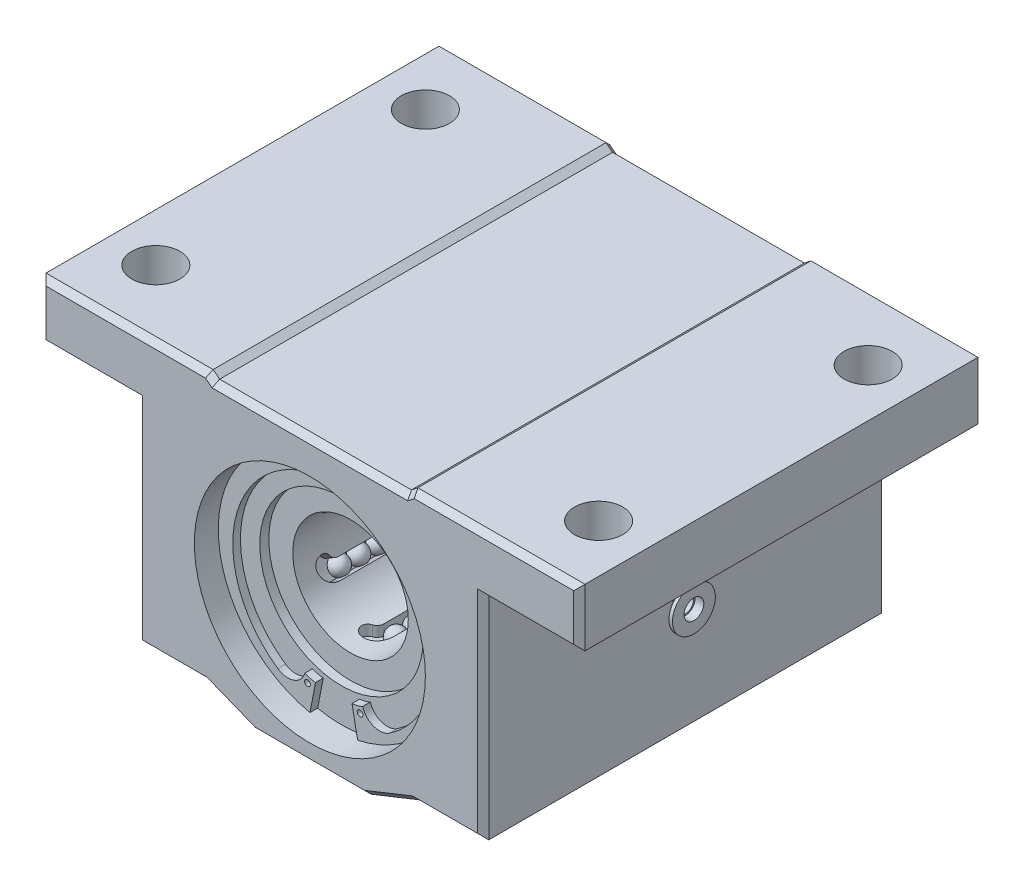
from build123d import *

# Parameters (mm, degrees)
EXTRUDE1_DEPTH          = 16.66875
SKETCH2_R               = 9.525
CUT_EXTRUDE1_DEPTH      = 2.607733333
SKETCH4_R               = 6.7389375
CUT_EXTRUDE2_DEPTH      = 0.745066669
SKETCH5_R               = 4.7625
CUT_EXTRUDE3_DEPTH      = 40.176416988
CUT_EXTRUDE4_REACH      = 32.546
CUT_EXTRUDE4_END_RADIUS = 5.609166668
CIRPATTERN1_COUNT       = 6
LPATTERN1_COUNT         = 7
LPATTERN1_PITCH         = 1.5875
CIRPATTERN2_COUNT       = 6
CHAMFER1_SIZE           = 0.465666667
SKETCH11_R              = 0.6985
CUT_EXTRUDE5_DEPTH      = 0.952499999
SKETCH13_R              = 1.984375
CUT_EXTRUDE6_DEPTH      = 4.7625
SKETCH3_R               = 0.238125
EXTRUDE2_DEPTH          = 0.635


with BuildPart() as part:
    # Sketch1 → Extrude1 (new, symmetric)
    with BuildSketch(Plane.XY):
        Polygon((-22.225, 11.90625), (-8.4455, 11.90625), (-7.90654375, 11.482916667), (7.90654375, 11.482916667), (8.4455, 11.90625), (22.225, 11.90625), (22.225, 7.14375), (14.2875, 7.14375), (14.2875, -10.31875), (8.5725, -10.31875), (4.591070255, -11.90625), (-4.591070255, -11.90625), (-8.5725, -10.31875), (-14.2875, -10.31875), (-14.2875, 7.14375), (-22.225, 7.14375), align=None)
    extrude(amount=EXTRUDE1_DEPTH, both=True)

    # Sketch2 → Cut-Extrude1 (cut)
    with BuildSketch(Plane.XY.offset(16.66875)):
        with Locations((0, -0.79375)):
            Circle(SKETCH2_R)
    cut_extrude1 = extrude(amount=-CUT_EXTRUDE1_DEPTH, mode=Mode.SUBTRACT)

    # Sketch4 → Cut-Extrude2 (cut)
    with BuildSketch(Plane.XY.offset(14.061016667)):
        with Locations((0, -0.79375)):
            Circle(SKETCH4_R)
    cut_extrude2 = extrude(amount=-CUT_EXTRUDE2_DEPTH, mode=Mode.SUBTRACT)

    # Mirror1: Cut-Extrude1, Cut-Extrude2 across plane
    add(cut_extrude1.mirror(Plane.XY), mode=Mode.SUBTRACT)
    add(cut_extrude2.mirror(Plane.XY), mode=Mode.SUBTRACT)

    # Sketch5 → Cut-Extrude3 (cut, through all)
    with BuildSketch(Plane.XY.offset(13.315949998)):
        with Locations((0, -0.79375)):
            Circle(SKETCH5_R)
    extrude(amount=-CUT_EXTRUDE3_DEPTH, mode=Mode.SUBTRACT)

    # Cut-Extrude4: up to this cylinder (the profile starts inside it)
    cut_extrude4_end = Plane(origin=(0, -0.79375, 1.100878), z_dir=(0, 0, 1)) * Cylinder(CUT_EXTRUDE4_END_RADIUS, 77.310333335, mode=Mode.PRIVATE)
    # Sketch8 → Cut-Extrude4 (cut, up to the surface)
    with BuildSketch(Plane(origin=(0, -0.79375, 0), x_dir=(-1, 0, 0), z_dir=(0, 1, 0)), mode=Mode.PRIVATE) as cut_extrude4_sk1:
        with BuildLine():
            Line((0.657225, 9.900558849), (0.657225, -7.698802135))
            ThreePointArc((0.657225, -7.698802135), (0.748651619, -8.048469056), (0.999529688, -8.308634344))
            ThreePointArc((0.999529688, -8.308634344), (1.289948445, -9.047460016), (0.657225, -9.526904976))
            ThreePointArc((0.657225, -9.526904976), (-0.272231509, -9.141911485), (-0.657225, -8.212454976))
            Line((-0.657225, -8.212454976), (-0.657225, 10.41421169))
            ThreePointArc((-0.657225, 10.41421169), (-0.272231509, 11.343668198), (0.657225, 11.72866169))
            ThreePointArc((0.657225, 11.72866169), (1.289948445, 11.24921673), (0.999529688, 10.510391058))
            ThreePointArc((0.999529688, 10.510391058), (0.748651619, 10.250225769), (0.657225, 9.900558849))
        make_face()
    cut_extrude4_tool1 = extrude(cut_extrude4_sk1.sketch, amount=-CUT_EXTRUDE4_REACH, mode=Mode.PRIVATE) & cut_extrude4_end
    cut_extrude4 = cut_extrude4_tool1.solids().sort_by_distance((-0.05578, -0.79375, 1.100878))[0]
    add(cut_extrude4, mode=Mode.SUBTRACT)

    # CirPattern1: Cut-Extrude4 ×6 about axis
    cirpattern1_axis = Axis((0, -0.79375, 0), (0, 0, 1))
    for i in range(1, CIRPATTERN1_COUNT):
        add(cut_extrude4.rotate(cirpattern1_axis, i * 360 / CIRPATTERN1_COUNT), mode=Mode.SUBTRACT)

    # Sketch10 → Revolve2 (revolve)
    with BuildSketch(Plane.XY):
        with BuildLine():
            Line((-0.776287501, -6.332537501), (0.776287501, -6.332537501))
            ThreePointArc((0.776287501, -6.332537501), (0, -5.55625), (-0.776287501, -6.332537501))
        make_face()
    revolve2 = revolve(axis=Axis((-0.776287501, -6.332537501, 0), (1, 0, 0)))

    # LPattern1: Revolve2 ×7
    with Locations(*[(0, 0, i * LPATTERN1_PITCH) for i in range(1, LPATTERN1_COUNT)]):
        add(revolve2)

    # Mirror5: Revolve2 across plane
    add(revolve2.mirror(Plane.XY))

    # Mirror5 copy 1 sketch → Mirror5 copy 1 (revolve)
    with BuildSketch(Plane(origin=(0, 0, -1.5875), x_dir=(1, 0, 0), z_dir=(0, 0, -1))):
        with BuildLine():
            Line((-0.776287501, 6.332537501), (0.776287501, 6.332537501))
            ThreePointArc((0.776287501, 6.332537501), (0, 5.55625), (-0.776287501, 6.332537501))
        make_face()
    revolve(axis=Axis((-0.776287501, -6.332537501, -1.5875), (-1, 0, 0)))

    # Mirror5 copy 2 sketch → Mirror5 copy 2 (revolve)
    with BuildSketch(Plane(origin=(0, 0, -3.175), x_dir=(1, 0, 0), z_dir=(0, 0, -1))):
        with BuildLine():
            Line((-0.776287501, 6.332537501), (0.776287501, 6.332537501))
            ThreePointArc((0.776287501, 6.332537501), (0, 5.55625), (-0.776287501, 6.332537501))
        make_face()
    revolve(axis=Axis((-0.776287501, -6.332537501, -3.175), (-1, 0, 0)))

    # Mirror5 copy 3 sketch → Mirror5 copy 3 (revolve)
    with BuildSketch(Plane(origin=(0, 0, -4.7625), x_dir=(1, 0, 0), z_dir=(0, 0, -1))):
        with BuildLine():
            Line((-0.776287501, 6.332537501), (0.776287501, 6.332537501))
            ThreePointArc((0.776287501, 6.332537501), (0, 5.55625), (-0.776287501, 6.332537501))
        make_face()
    revolve(axis=Axis((-0.776287501, -6.332537501, -4.7625), (-1, 0, 0)))

    # Mirror5 copy 4 sketch → Mirror5 copy 4 (revolve)
    with BuildSketch(Plane(origin=(0, 0, -6.35), x_dir=(1, 0, 0), z_dir=(0, 0, -1))):
        with BuildLine():
            Line((-0.776287501, 6.332537501), (0.776287501, 6.332537501))
            ThreePointArc((0.776287501, 6.332537501), (0, 5.55625), (-0.776287501, 6.332537501))
        make_face()
    revolve(axis=Axis((-0.776287501, -6.332537501, -6.35), (-1, 0, 0)))

    # Mirror5 copy 5 sketch → Mirror5 copy 5 (revolve)
    with BuildSketch(Plane(origin=(0, 0, -7.9375), x_dir=(1, 0, 0), z_dir=(0, 0, -1))):
        with BuildLine():
            Line((-0.776287501, 6.332537501), (0.776287501, 6.332537501))
            ThreePointArc((0.776287501, 6.332537501), (0, 5.55625), (-0.776287501, 6.332537501))
        make_face()
    revolve(axis=Axis((-0.776287501, -6.332537501, -7.9375), (-1, 0, 0)))

    # Mirror5 copy 6 sketch → Mirror5 copy 6 (revolve)
    with BuildSketch(Plane(origin=(0, 0, -9.525), x_dir=(1, 0, 0), z_dir=(0, 0, -1))):
        with BuildLine():
            Line((-0.776287501, 6.332537501), (0.776287501, 6.332537501))
            ThreePointArc((0.776287501, 6.332537501), (0, 5.55625), (-0.776287501, 6.332537501))
        make_face()
    revolve(axis=Axis((-0.776287501, -6.332537501, -9.525), (-1, 0, 0)))

    # CirPattern2: Revolve2 ×6 about axis
    cirpattern2_axis = Axis((0, -0.79375, 0), (0, 0, 1))
    for i in range(1, CIRPATTERN2_COUNT):
        add(revolve2.rotate(cirpattern2_axis, i * 360 / CIRPATTERN2_COUNT))

    # CirPattern2 copy 1 sketch → CirPattern2 copy 1 (revolve)
    with BuildSketch(Plane(origin=(-0.687407664, -0.396875, 1.5875), x_dir=(0.5000000000000001, 0.8660254037844386, 0), z_dir=(0, 0, 1))):
        with BuildLine():
            Line((-0.776287501, -6.332537501), (0.776287501, -6.332537501))
            ThreePointArc((0.776287501, -6.332537501), (0, -5.55625), (-0.776287501, -6.332537501))
        make_face()
    revolve(axis=Axis((4.408586932, -4.235428447, 1.5875), (0.5000000000000001, 0.8660254037844386, 0)))

    # CirPattern2 copy 2 sketch → CirPattern2 copy 2 (revolve)
    with BuildSketch(Plane(origin=(-0.687407664, -1.190625, 1.5875), x_dir=(-0.4999999999999998, 0.8660254037844387, 0), z_dir=(0, 0, 1))):
        with BuildLine():
            Line((-0.776287501, -6.332537501), (0.776287501, -6.332537501))
            ThreePointArc((0.776287501, -6.332537501), (0, -5.55625), (-0.776287501, -6.332537501))
        make_face()
    revolve(axis=Axis((5.184874432, 1.303359054, 1.5875), (-0.4999999999999998, 0.8660254037844387, 0)))

    # CirPattern2 copy 3 sketch → CirPattern2 copy 3 (revolve)
    with BuildSketch(Plane(origin=(0, -1.5875, 1.5875), x_dir=(-1, 0, 0), z_dir=(0, 0, 1))):
        with BuildLine():
            Line((-0.776287501, -6.332537501), (0.776287501, -6.332537501))
            ThreePointArc((0.776287501, -6.332537501), (0, -5.55625), (-0.776287501, -6.332537501))
        make_face()
    revolve(axis=Axis((0.776287501, 4.745037501, 1.5875), (-1, 0, 0)))

    # CirPattern2 copy 4 sketch → CirPattern2 copy 4 (revolve)
    with BuildSketch(Plane(origin=(0.687407664, -1.190625, 1.5875), x_dir=(-0.5000000000000004, -0.8660254037844384, 0), z_dir=(0, 0, 1))):
        with BuildLine():
            Line((-0.776287501, -6.332537501), (0.776287501, -6.332537501))
            ThreePointArc((0.776287501, -6.332537501), (0, -5.55625), (-0.776287501, -6.332537501))
        make_face()
    revolve(axis=Axis((-4.408586932, 2.647928447, 1.5875), (-0.5000000000000004, -0.8660254037844384, 0)))

    # CirPattern2 copy 5 sketch → CirPattern2 copy 5 (revolve)
    with BuildSketch(Plane(origin=(0.687407664, -0.396875, 1.5875), x_dir=(0.5000000000000001, -0.8660254037844386, 0), z_dir=(0, 0, 1))):
        with BuildLine():
            Line((-0.776287501, -6.332537501), (0.776287501, -6.332537501))
            ThreePointArc((0.776287501, -6.332537501), (0, -5.55625), (-0.776287501, -6.332537501))
        make_face()
    revolve(axis=Axis((-5.184874432, -2.890859054, 1.5875), (0.5000000000000001, -0.8660254037844386, 0)))

    # CirPattern2 copy 6 sketch → CirPattern2 copy 6 (revolve)
    with BuildSketch(Plane(origin=(-0.687407664, -0.396875, 3.175), x_dir=(0.5000000000000001, 0.8660254037844386, 0), z_dir=(0, 0, 1))):
        with BuildLine():
            Line((-0.776287501, -6.332537501), (0.776287501, -6.332537501))
            ThreePointArc((0.776287501, -6.332537501), (0, -5.55625), (-0.776287501, -6.332537501))
        make_face()
    revolve(axis=Axis((4.408586932, -4.235428447, 3.175), (0.5000000000000001, 0.8660254037844386, 0)))

    # CirPattern2 copy 7 sketch → CirPattern2 copy 7 (revolve)
    with BuildSketch(Plane(origin=(-0.687407664, -1.190625, 3.175), x_dir=(-0.4999999999999998, 0.8660254037844387, 0), z_dir=(0, 0, 1))):
        with BuildLine():
            Line((-0.776287501, -6.332537501), (0.776287501, -6.332537501))
            ThreePointArc((0.776287501, -6.332537501), (0, -5.55625), (-0.776287501, -6.332537501))
        make_face()
    revolve(axis=Axis((5.184874432, 1.303359054, 3.175), (-0.4999999999999998, 0.8660254037844387, 0)))

    # CirPattern2 copy 8 sketch → CirPattern2 copy 8 (revolve)
    with BuildSketch(Plane(origin=(0, -1.5875, 3.175), x_dir=(-1, 0, 0), z_dir=(0, 0, 1))):
        with BuildLine():
            Line((-0.776287501, -6.332537501), (0.776287501, -6.332537501))
            ThreePointArc((0.776287501, -6.332537501), (0, -5.55625), (-0.776287501, -6.332537501))
        make_face()
    revolve(axis=Axis((0.776287501, 4.745037501, 3.175), (-1, 0, 0)))

    # CirPattern2 copy 9 sketch → CirPattern2 copy 9 (revolve)
    with BuildSketch(Plane(origin=(0.687407664, -1.190625, 3.175), x_dir=(-0.5000000000000004, -0.8660254037844384, 0), z_dir=(0, 0, 1))):
        with BuildLine():
            Line((-0.776287501, -6.332537501), (0.776287501, -6.332537501))
            ThreePointArc((0.776287501, -6.332537501), (0, -5.55625), (-0.776287501, -6.332537501))
        make_face()
    revolve(axis=Axis((-4.408586932, 2.647928447, 3.175), (-0.5000000000000004, -0.8660254037844384, 0)))

    # CirPattern2 copy 10 sketch → CirPattern2 copy 10 (revolve)
    with BuildSketch(Plane(origin=(0.687407664, -0.396875, 3.175), x_dir=(0.5000000000000001, -0.8660254037844386, 0), z_dir=(0, 0, 1))):
        with BuildLine():
            Line((-0.776287501, -6.332537501), (0.776287501, -6.332537501))
            ThreePointArc((0.776287501, -6.332537501), (0, -5.55625), (-0.776287501, -6.332537501))
        make_face()
    revolve(axis=Axis((-5.184874432, -2.890859054, 3.175), (0.5000000000000001, -0.8660254037844386, 0)))

    # CirPattern2 copy 11 sketch → CirPattern2 copy 11 (revolve)
    with BuildSketch(Plane(origin=(-0.687407664, -0.396875, 4.7625), x_dir=(0.5000000000000001, 0.8660254037844386, 0), z_dir=(0, 0, 1))):
        with BuildLine():
            Line((-0.776287501, -6.332537501), (0.776287501, -6.332537501))
            ThreePointArc((0.776287501, -6.332537501), (0, -5.55625), (-0.776287501, -6.332537501))
        make_face()
    revolve(axis=Axis((4.408586932, -4.235428447, 4.7625), (0.5000000000000001, 0.8660254037844386, 0)))

    # CirPattern2 copy 12 sketch → CirPattern2 copy 12 (revolve)
    with BuildSketch(Plane(origin=(-0.687407664, -1.190625, 4.7625), x_dir=(-0.4999999999999998, 0.8660254037844387, 0), z_dir=(0, 0, 1))):
        with BuildLine():
            Line((-0.776287501, -6.332537501), (0.776287501, -6.332537501))
            ThreePointArc((0.776287501, -6.332537501), (0, -5.55625), (-0.776287501, -6.332537501))
        make_face()
    revolve(axis=Axis((5.184874432, 1.303359054, 4.7625), (-0.4999999999999998, 0.8660254037844387, 0)))

    # CirPattern2 copy 13 sketch → CirPattern2 copy 13 (revolve)
    with BuildSketch(Plane(origin=(0, -1.5875, 4.7625), x_dir=(-1, 0, 0), z_dir=(0, 0, 1))):
        with BuildLine():
            Line((-0.776287501, -6.332537501), (0.776287501, -6.332537501))
            ThreePointArc((0.776287501, -6.332537501), (0, -5.55625), (-0.776287501, -6.332537501))
        make_face()
    revolve(axis=Axis((0.776287501, 4.745037501, 4.7625), (-1, 0, 0)))

    # CirPattern2 copy 14 sketch → CirPattern2 copy 14 (revolve)
    with BuildSketch(Plane(origin=(0.687407664, -1.190625, 4.7625), x_dir=(-0.5000000000000004, -0.8660254037844384, 0), z_dir=(0, 0, 1))):
        with BuildLine():
            Line((-0.776287501, -6.332537501), (0.776287501, -6.332537501))
            ThreePointArc((0.776287501, -6.332537501), (0, -5.55625), (-0.776287501, -6.332537501))
        make_face()
    revolve(axis=Axis((-4.408586932, 2.647928447, 4.7625), (-0.5000000000000004, -0.8660254037844384, 0)))

    # CirPattern2 copy 15 sketch → CirPattern2 copy 15 (revolve)
    with BuildSketch(Plane(origin=(0.687407664, -0.396875, 4.7625), x_dir=(0.5000000000000001, -0.8660254037844386, 0), z_dir=(0, 0, 1))):
        with BuildLine():
            Line((-0.776287501, -6.332537501), (0.776287501, -6.332537501))
            ThreePointArc((0.776287501, -6.332537501), (0, -5.55625), (-0.776287501, -6.332537501))
        make_face()
    revolve(axis=Axis((-5.184874432, -2.890859054, 4.7625), (0.5000000000000001, -0.8660254037844386, 0)))

    # CirPattern2 copy 16 sketch → CirPattern2 copy 16 (revolve)
    with BuildSketch(Plane(origin=(-0.687407664, -0.396875, 6.35), x_dir=(0.5000000000000001, 0.8660254037844386, 0), z_dir=(0, 0, 1))):
        with BuildLine():
            Line((-0.776287501, -6.332537501), (0.776287501, -6.332537501))
            ThreePointArc((0.776287501, -6.332537501), (0, -5.55625), (-0.776287501, -6.332537501))
        make_face()
    revolve(axis=Axis((4.408586932, -4.235428447, 6.35), (0.5000000000000001, 0.8660254037844386, 0)))

    # CirPattern2 copy 17 sketch → CirPattern2 copy 17 (revolve)
    with BuildSketch(Plane(origin=(-0.687407664, -1.190625, 6.35), x_dir=(-0.4999999999999998, 0.8660254037844387, 0), z_dir=(0, 0, 1))):
        with BuildLine():
            Line((-0.776287501, -6.332537501), (0.776287501, -6.332537501))
            ThreePointArc((0.776287501, -6.332537501), (0, -5.55625), (-0.776287501, -6.332537501))
        make_face()
    revolve(axis=Axis((5.184874432, 1.303359054, 6.35), (-0.4999999999999998, 0.8660254037844387, 0)))

    # CirPattern2 copy 18 sketch → CirPattern2 copy 18 (revolve)
    with BuildSketch(Plane(origin=(0, -1.5875, 6.35), x_dir=(-1, 0, 0), z_dir=(0, 0, 1))):
        with BuildLine():
            Line((-0.776287501, -6.332537501), (0.776287501, -6.332537501))
            ThreePointArc((0.776287501, -6.332537501), (0, -5.55625), (-0.776287501, -6.332537501))
        make_face()
    revolve(axis=Axis((0.776287501, 4.745037501, 6.35), (-1, 0, 0)))

    # CirPattern2 copy 19 sketch → CirPattern2 copy 19 (revolve)
    with BuildSketch(Plane(origin=(0.687407664, -1.190625, 6.35), x_dir=(-0.5000000000000004, -0.8660254037844384, 0), z_dir=(0, 0, 1))):
        with BuildLine():
            Line((-0.776287501, -6.332537501), (0.776287501, -6.332537501))
            ThreePointArc((0.776287501, -6.332537501), (0, -5.55625), (-0.776287501, -6.332537501))
        make_face()
    revolve(axis=Axis((-4.408586932, 2.647928447, 6.35), (-0.5000000000000004, -0.8660254037844384, 0)))

    # CirPattern2 copy 20 sketch → CirPattern2 copy 20 (revolve)
    with BuildSketch(Plane(origin=(0.687407664, -0.396875, 6.35), x_dir=(0.5000000000000001, -0.8660254037844386, 0), z_dir=(0, 0, 1))):
        with BuildLine():
            Line((-0.776287501, -6.332537501), (0.776287501, -6.332537501))
            ThreePointArc((0.776287501, -6.332537501), (0, -5.55625), (-0.776287501, -6.332537501))
        make_face()
    revolve(axis=Axis((-5.184874432, -2.890859054, 6.35), (0.5000000000000001, -0.8660254037844386, 0)))

    # CirPattern2 copy 21 sketch → CirPattern2 copy 21 (revolve)
    with BuildSketch(Plane(origin=(-0.687407664, -0.396875, 7.9375), x_dir=(0.5000000000000001, 0.8660254037844386, 0), z_dir=(0, 0, 1))):
        with BuildLine():
            Line((-0.776287501, -6.332537501), (0.776287501, -6.332537501))
            ThreePointArc((0.776287501, -6.332537501), (0, -5.55625), (-0.776287501, -6.332537501))
        make_face()
    revolve(axis=Axis((4.408586932, -4.235428447, 7.9375), (0.5000000000000001, 0.8660254037844386, 0)))

    # CirPattern2 copy 22 sketch → CirPattern2 copy 22 (revolve)
    with BuildSketch(Plane(origin=(-0.687407664, -1.190625, 7.9375), x_dir=(-0.4999999999999998, 0.8660254037844387, 0), z_dir=(0, 0, 1))):
        with BuildLine():
            Line((-0.776287501, -6.332537501), (0.776287501, -6.332537501))
            ThreePointArc((0.776287501, -6.332537501), (0, -5.55625), (-0.776287501, -6.332537501))
        make_face()
    revolve(axis=Axis((5.184874432, 1.303359054, 7.9375), (-0.4999999999999998, 0.8660254037844387, 0)))

    # CirPattern2 copy 23 sketch → CirPattern2 copy 23 (revolve)
    with BuildSketch(Plane(origin=(0, -1.5875, 7.9375), x_dir=(-1, 0, 0), z_dir=(0, 0, 1))):
        with BuildLine():
            Line((-0.776287501, -6.332537501), (0.776287501, -6.332537501))
            ThreePointArc((0.776287501, -6.332537501), (0, -5.55625), (-0.776287501, -6.332537501))
        make_face()
    revolve(axis=Axis((0.776287501, 4.745037501, 7.9375), (-1, 0, 0)))

    # CirPattern2 copy 24 sketch → CirPattern2 copy 24 (revolve)
    with BuildSketch(Plane(origin=(0.687407664, -1.190625, 7.9375), x_dir=(-0.5000000000000004, -0.8660254037844384, 0), z_dir=(0, 0, 1))):
        with BuildLine():
            Line((-0.776287501, -6.332537501), (0.776287501, -6.332537501))
            ThreePointArc((0.776287501, -6.332537501), (0, -5.55625), (-0.776287501, -6.332537501))
        make_face()
    revolve(axis=Axis((-4.408586932, 2.647928447, 7.9375), (-0.5000000000000004, -0.8660254037844384, 0)))

    # CirPattern2 copy 25 sketch → CirPattern2 copy 25 (revolve)
    with BuildSketch(Plane(origin=(0.687407664, -0.396875, 7.9375), x_dir=(0.5000000000000001, -0.8660254037844386, 0), z_dir=(0, 0, 1))):
        with BuildLine():
            Line((-0.776287501, -6.332537501), (0.776287501, -6.332537501))
            ThreePointArc((0.776287501, -6.332537501), (0, -5.55625), (-0.776287501, -6.332537501))
        make_face()
    revolve(axis=Axis((-5.184874432, -2.890859054, 7.9375), (0.5000000000000001, -0.8660254037844386, 0)))

    # CirPattern2 copy 26 sketch → CirPattern2 copy 26 (revolve)
    with BuildSketch(Plane(origin=(-0.687407664, -0.396875, 9.525), x_dir=(0.5000000000000001, 0.8660254037844386, 0), z_dir=(0, 0, 1))):
        with BuildLine():
            Line((-0.776287501, -6.332537501), (0.776287501, -6.332537501))
            ThreePointArc((0.776287501, -6.332537501), (0, -5.55625), (-0.776287501, -6.332537501))
        make_face()
    revolve(axis=Axis((4.408586932, -4.235428447, 9.525), (0.5000000000000001, 0.8660254037844386, 0)))

    # CirPattern2 copy 27 sketch → CirPattern2 copy 27 (revolve)
    with BuildSketch(Plane(origin=(-0.687407664, -1.190625, 9.525), x_dir=(-0.4999999999999998, 0.8660254037844387, 0), z_dir=(0, 0, 1))):
        with BuildLine():
            Line((-0.776287501, -6.332537501), (0.776287501, -6.332537501))
            ThreePointArc((0.776287501, -6.332537501), (0, -5.55625), (-0.776287501, -6.332537501))
        make_face()
    revolve(axis=Axis((5.184874432, 1.303359054, 9.525), (-0.4999999999999998, 0.8660254037844387, 0)))

    # CirPattern2 copy 28 sketch → CirPattern2 copy 28 (revolve)
    with BuildSketch(Plane(origin=(0, -1.5875, 9.525), x_dir=(-1, 0, 0), z_dir=(0, 0, 1))):
        with BuildLine():
            Line((-0.776287501, -6.332537501), (0.776287501, -6.332537501))
            ThreePointArc((0.776287501, -6.332537501), (0, -5.55625), (-0.776287501, -6.332537501))
        make_face()
    revolve(axis=Axis((0.776287501, 4.745037501, 9.525), (-1, 0, 0)))

    # CirPattern2 copy 29 sketch → CirPattern2 copy 29 (revolve)
    with BuildSketch(Plane(origin=(0.687407664, -1.190625, 9.525), x_dir=(-0.5000000000000004, -0.8660254037844384, 0), z_dir=(0, 0, 1))):
        with BuildLine():
            Line((-0.776287501, -6.332537501), (0.776287501, -6.332537501))
            ThreePointArc((0.776287501, -6.332537501), (0, -5.55625), (-0.776287501, -6.332537501))
        make_face()
    revolve(axis=Axis((-4.408586932, 2.647928447, 9.525), (-0.5000000000000004, -0.8660254037844384, 0)))

    # CirPattern2 copy 30 sketch → CirPattern2 copy 30 (revolve)
    with BuildSketch(Plane(origin=(0.687407664, -0.396875, 9.525), x_dir=(0.5000000000000001, -0.8660254037844386, 0), z_dir=(0, 0, 1))):
        with BuildLine():
            Line((-0.776287501, -6.332537501), (0.776287501, -6.332537501))
            ThreePointArc((0.776287501, -6.332537501), (0, -5.55625), (-0.776287501, -6.332537501))
        make_face()
    revolve(axis=Axis((-5.184874432, -2.890859054, 9.525), (0.5000000000000001, -0.8660254037844386, 0)))

    # CirPattern2 copy 31 sketch → CirPattern2 copy 31 (revolve)
    with BuildSketch(Plane(origin=(-0.687407664, -0.396875, 0), x_dir=(0.5000000000000001, 0.8660254037844386, 0), z_dir=(0, 0, -1))):
        with BuildLine():
            Line((-0.776287501, 6.332537501), (0.776287501, 6.332537501))
            ThreePointArc((0.776287501, 6.332537501), (0, 5.55625), (-0.776287501, 6.332537501))
        make_face()
    revolve(axis=Axis((4.408586932, -4.235428447, 0), (-0.5000000000000001, -0.8660254037844386, 0)))

    # CirPattern2 copy 32 sketch → CirPattern2 copy 32 (revolve)
    with BuildSketch(Plane(origin=(-0.687407664, -1.190625, 0), x_dir=(-0.4999999999999998, 0.8660254037844387, 0), z_dir=(0, 0, -1))):
        with BuildLine():
            Line((-0.776287501, 6.332537501), (0.776287501, 6.332537501))
            ThreePointArc((0.776287501, 6.332537501), (0, 5.55625), (-0.776287501, 6.332537501))
        make_face()
    revolve(axis=Axis((5.184874432, 1.303359054, 0), (0.4999999999999998, -0.8660254037844387, 0)))

    # CirPattern2 copy 33 sketch → CirPattern2 copy 33 (revolve)
    with BuildSketch(Plane(origin=(0, -1.5875, 0), x_dir=(-1, 0, 0), z_dir=(0, 0, -1))):
        with BuildLine():
            Line((-0.776287501, 6.332537501), (0.776287501, 6.332537501))
            ThreePointArc((0.776287501, 6.332537501), (0, 5.55625), (-0.776287501, 6.332537501))
        make_face()
    revolve(axis=Axis((0.776287501, 4.745037501, 0), (1, 0, 0)))

    # CirPattern2 copy 34 sketch → CirPattern2 copy 34 (revolve)
    with BuildSketch(Plane(origin=(0.687407664, -1.190625, 0), x_dir=(-0.5000000000000004, -0.8660254037844384, 0), z_dir=(0, 0, -1))):
        with BuildLine():
            Line((-0.776287501, 6.332537501), (0.776287501, 6.332537501))
            ThreePointArc((0.776287501, 6.332537501), (0, 5.55625), (-0.776287501, 6.332537501))
        make_face()
    revolve(axis=Axis((-4.408586932, 2.647928447, 0), (0.5000000000000004, 0.8660254037844384, 0)))

    # CirPattern2 copy 35 sketch → CirPattern2 copy 35 (revolve)
    with BuildSketch(Plane(origin=(0.687407664, -0.396875, 0), x_dir=(0.5000000000000001, -0.8660254037844386, 0), z_dir=(0, 0, -1))):
        with BuildLine():
            Line((-0.776287501, 6.332537501), (0.776287501, 6.332537501))
            ThreePointArc((0.776287501, 6.332537501), (0, 5.55625), (-0.776287501, 6.332537501))
        make_face()
    revolve(axis=Axis((-5.184874432, -2.890859054, 0), (-0.5000000000000001, 0.8660254037844386, 0)))

    # CirPattern2 copy 36 sketch → CirPattern2 copy 36 (revolve)
    with BuildSketch(Plane(origin=(-0.687407664, -0.396875, -1.5875), x_dir=(0.5000000000000001, 0.8660254037844386, 0), z_dir=(0, 0, -1))):
        with BuildLine():
            Line((-0.776287501, 6.332537501), (0.776287501, 6.332537501))
            ThreePointArc((0.776287501, 6.332537501), (0, 5.55625), (-0.776287501, 6.332537501))
        make_face()
    revolve(axis=Axis((4.408586932, -4.235428447, -1.5875), (-0.5000000000000001, -0.8660254037844386, 0)))

    # CirPattern2 copy 37 sketch → CirPattern2 copy 37 (revolve)
    with BuildSketch(Plane(origin=(-0.687407664, -1.190625, -1.5875), x_dir=(-0.4999999999999998, 0.8660254037844387, 0), z_dir=(0, 0, -1))):
        with BuildLine():
            Line((-0.776287501, 6.332537501), (0.776287501, 6.332537501))
            ThreePointArc((0.776287501, 6.332537501), (0, 5.55625), (-0.776287501, 6.332537501))
        make_face()
    revolve(axis=Axis((5.184874432, 1.303359054, -1.5875), (0.4999999999999998, -0.8660254037844387, 0)))

    # CirPattern2 copy 38 sketch → CirPattern2 copy 38 (revolve)
    with BuildSketch(Plane(origin=(0, -1.5875, -1.5875), x_dir=(-1, 0, 0), z_dir=(0, 0, -1))):
        with BuildLine():
            Line((-0.776287501, 6.332537501), (0.776287501, 6.332537501))
            ThreePointArc((0.776287501, 6.332537501), (0, 5.55625), (-0.776287501, 6.332537501))
        make_face()
    revolve(axis=Axis((0.776287501, 4.745037501, -1.5875), (1, 0, 0)))

    # CirPattern2 copy 39 sketch → CirPattern2 copy 39 (revolve)
    with BuildSketch(Plane(origin=(0.687407664, -1.190625, -1.5875), x_dir=(-0.5000000000000004, -0.8660254037844384, 0), z_dir=(0, 0, -1))):
        with BuildLine():
            Line((-0.776287501, 6.332537501), (0.776287501, 6.332537501))
            ThreePointArc((0.776287501, 6.332537501), (0, 5.55625), (-0.776287501, 6.332537501))
        make_face()
    revolve(axis=Axis((-4.408586932, 2.647928447, -1.5875), (0.5000000000000004, 0.8660254037844384, 0)))

    # CirPattern2 copy 40 sketch → CirPattern2 copy 40 (revolve)
    with BuildSketch(Plane(origin=(0.687407664, -0.396875, -1.5875), x_dir=(0.5000000000000001, -0.8660254037844386, 0), z_dir=(0, 0, -1))):
        with BuildLine():
            Line((-0.776287501, 6.332537501), (0.776287501, 6.332537501))
            ThreePointArc((0.776287501, 6.332537501), (0, 5.55625), (-0.776287501, 6.332537501))
        make_face()
    revolve(axis=Axis((-5.184874432, -2.890859054, -1.5875), (-0.5000000000000001, 0.8660254037844386, 0)))

    # CirPattern2 copy 41 sketch → CirPattern2 copy 41 (revolve)
    with BuildSketch(Plane(origin=(-0.687407664, -0.396875, -3.175), x_dir=(0.5000000000000001, 0.8660254037844386, 0), z_dir=(0, 0, -1))):
        with BuildLine():
            Line((-0.776287501, 6.332537501), (0.776287501, 6.332537501))
            ThreePointArc((0.776287501, 6.332537501), (0, 5.55625), (-0.776287501, 6.332537501))
        make_face()
    revolve(axis=Axis((4.408586932, -4.235428447, -3.175), (-0.5000000000000001, -0.8660254037844386, 0)))

    # CirPattern2 copy 42 sketch → CirPattern2 copy 42 (revolve)
    with BuildSketch(Plane(origin=(-0.687407664, -1.190625, -3.175), x_dir=(-0.4999999999999998, 0.8660254037844387, 0), z_dir=(0, 0, -1))):
        with BuildLine():
            Line((-0.776287501, 6.332537501), (0.776287501, 6.332537501))
            ThreePointArc((0.776287501, 6.332537501), (0, 5.55625), (-0.776287501, 6.332537501))
        make_face()
    revolve(axis=Axis((5.184874432, 1.303359054, -3.175), (0.4999999999999998, -0.8660254037844387, 0)))

    # CirPattern2 copy 43 sketch → CirPattern2 copy 43 (revolve)
    with BuildSketch(Plane(origin=(0, -1.5875, -3.175), x_dir=(-1, 0, 0), z_dir=(0, 0, -1))):
        with BuildLine():
            Line((-0.776287501, 6.332537501), (0.776287501, 6.332537501))
            ThreePointArc((0.776287501, 6.332537501), (0, 5.55625), (-0.776287501, 6.332537501))
        make_face()
    revolve(axis=Axis((0.776287501, 4.745037501, -3.175), (1, 0, 0)))

    # CirPattern2 copy 44 sketch → CirPattern2 copy 44 (revolve)
    with BuildSketch(Plane(origin=(0.687407664, -1.190625, -3.175), x_dir=(-0.5000000000000004, -0.8660254037844384, 0), z_dir=(0, 0, -1))):
        with BuildLine():
            Line((-0.776287501, 6.332537501), (0.776287501, 6.332537501))
            ThreePointArc((0.776287501, 6.332537501), (0, 5.55625), (-0.776287501, 6.332537501))
        make_face()
    revolve(axis=Axis((-4.408586932, 2.647928447, -3.175), (0.5000000000000004, 0.8660254037844384, 0)))

    # CirPattern2 copy 45 sketch → CirPattern2 copy 45 (revolve)
    with BuildSketch(Plane(origin=(0.687407664, -0.396875, -3.175), x_dir=(0.5000000000000001, -0.8660254037844386, 0), z_dir=(0, 0, -1))):
        with BuildLine():
            Line((-0.776287501, 6.332537501), (0.776287501, 6.332537501))
            ThreePointArc((0.776287501, 6.332537501), (0, 5.55625), (-0.776287501, 6.332537501))
        make_face()
    revolve(axis=Axis((-5.184874432, -2.890859054, -3.175), (-0.5000000000000001, 0.8660254037844386, 0)))

    # CirPattern2 copy 46 sketch → CirPattern2 copy 46 (revolve)
    with BuildSketch(Plane(origin=(-0.687407664, -0.396875, -4.7625), x_dir=(0.5000000000000001, 0.8660254037844386, 0), z_dir=(0, 0, -1))):
        with BuildLine():
            Line((-0.776287501, 6.332537501), (0.776287501, 6.332537501))
            ThreePointArc((0.776287501, 6.332537501), (0, 5.55625), (-0.776287501, 6.332537501))
        make_face()
    revolve(axis=Axis((4.408586932, -4.235428447, -4.7625), (-0.5000000000000001, -0.8660254037844386, 0)))

    # CirPattern2 copy 47 sketch → CirPattern2 copy 47 (revolve)
    with BuildSketch(Plane(origin=(-0.687407664, -1.190625, -4.7625), x_dir=(-0.4999999999999998, 0.8660254037844387, 0), z_dir=(0, 0, -1))):
        with BuildLine():
            Line((-0.776287501, 6.332537501), (0.776287501, 6.332537501))
            ThreePointArc((0.776287501, 6.332537501), (0, 5.55625), (-0.776287501, 6.332537501))
        make_face()
    revolve(axis=Axis((5.184874432, 1.303359054, -4.7625), (0.4999999999999998, -0.8660254037844387, 0)))

    # CirPattern2 copy 48 sketch → CirPattern2 copy 48 (revolve)
    with BuildSketch(Plane(origin=(0, -1.5875, -4.7625), x_dir=(-1, 0, 0), z_dir=(0, 0, -1))):
        with BuildLine():
            Line((-0.776287501, 6.332537501), (0.776287501, 6.332537501))
            ThreePointArc((0.776287501, 6.332537501), (0, 5.55625), (-0.776287501, 6.332537501))
        make_face()
    revolve(axis=Axis((0.776287501, 4.745037501, -4.7625), (1, 0, 0)))

    # CirPattern2 copy 49 sketch → CirPattern2 copy 49 (revolve)
    with BuildSketch(Plane(origin=(0.687407664, -1.190625, -4.7625), x_dir=(-0.5000000000000004, -0.8660254037844384, 0), z_dir=(0, 0, -1))):
        with BuildLine():
            Line((-0.776287501, 6.332537501), (0.776287501, 6.332537501))
            ThreePointArc((0.776287501, 6.332537501), (0, 5.55625), (-0.776287501, 6.332537501))
        make_face()
    revolve(axis=Axis((-4.408586932, 2.647928447, -4.7625), (0.5000000000000004, 0.8660254037844384, 0)))

    # CirPattern2 copy 50 sketch → CirPattern2 copy 50 (revolve)
    with BuildSketch(Plane(origin=(0.687407664, -0.396875, -4.7625), x_dir=(0.5000000000000001, -0.8660254037844386, 0), z_dir=(0, 0, -1))):
        with BuildLine():
            Line((-0.776287501, 6.332537501), (0.776287501, 6.332537501))
            ThreePointArc((0.776287501, 6.332537501), (0, 5.55625), (-0.776287501, 6.332537501))
        make_face()
    revolve(axis=Axis((-5.184874432, -2.890859054, -4.7625), (-0.5000000000000001, 0.8660254037844386, 0)))

    # CirPattern2 copy 51 sketch → CirPattern2 copy 51 (revolve)
    with BuildSketch(Plane(origin=(-0.687407664, -0.396875, -6.35), x_dir=(0.5000000000000001, 0.8660254037844386, 0), z_dir=(0, 0, -1))):
        with BuildLine():
            Line((-0.776287501, 6.332537501), (0.776287501, 6.332537501))
            ThreePointArc((0.776287501, 6.332537501), (0, 5.55625), (-0.776287501, 6.332537501))
        make_face()
    revolve(axis=Axis((4.408586932, -4.235428447, -6.35), (-0.5000000000000001, -0.8660254037844386, 0)))

    # CirPattern2 copy 52 sketch → CirPattern2 copy 52 (revolve)
    with BuildSketch(Plane(origin=(-0.687407664, -1.190625, -6.35), x_dir=(-0.4999999999999998, 0.8660254037844387, 0), z_dir=(0, 0, -1))):
        with BuildLine():
            Line((-0.776287501, 6.332537501), (0.776287501, 6.332537501))
            ThreePointArc((0.776287501, 6.332537501), (0, 5.55625), (-0.776287501, 6.332537501))
        make_face()
    revolve(axis=Axis((5.184874432, 1.303359054, -6.35), (0.4999999999999998, -0.8660254037844387, 0)))

    # CirPattern2 copy 53 sketch → CirPattern2 copy 53 (revolve)
    with BuildSketch(Plane(origin=(0, -1.5875, -6.35), x_dir=(-1, 0, 0), z_dir=(0, 0, -1))):
        with BuildLine():
            Line((-0.776287501, 6.332537501), (0.776287501, 6.332537501))
            ThreePointArc((0.776287501, 6.332537501), (0, 5.55625), (-0.776287501, 6.332537501))
        make_face()
    revolve(axis=Axis((0.776287501, 4.745037501, -6.35), (1, 0, 0)))

    # CirPattern2 copy 54 sketch → CirPattern2 copy 54 (revolve)
    with BuildSketch(Plane(origin=(0.687407664, -1.190625, -6.35), x_dir=(-0.5000000000000004, -0.8660254037844384, 0), z_dir=(0, 0, -1))):
        with BuildLine():
            Line((-0.776287501, 6.332537501), (0.776287501, 6.332537501))
            ThreePointArc((0.776287501, 6.332537501), (0, 5.55625), (-0.776287501, 6.332537501))
        make_face()
    revolve(axis=Axis((-4.408586932, 2.647928447, -6.35), (0.5000000000000004, 0.8660254037844384, 0)))

    # CirPattern2 copy 55 sketch → CirPattern2 copy 55 (revolve)
    with BuildSketch(Plane(origin=(0.687407664, -0.396875, -6.35), x_dir=(0.5000000000000001, -0.8660254037844386, 0), z_dir=(0, 0, -1))):
        with BuildLine():
            Line((-0.776287501, 6.332537501), (0.776287501, 6.332537501))
            ThreePointArc((0.776287501, 6.332537501), (0, 5.55625), (-0.776287501, 6.332537501))
        make_face()
    revolve(axis=Axis((-5.184874432, -2.890859054, -6.35), (-0.5000000000000001, 0.8660254037844386, 0)))

    # CirPattern2 copy 56 sketch → CirPattern2 copy 56 (revolve)
    with BuildSketch(Plane(origin=(-0.687407664, -0.396875, -7.9375), x_dir=(0.5000000000000001, 0.8660254037844386, 0), z_dir=(0, 0, -1))):
        with BuildLine():
            Line((-0.776287501, 6.332537501), (0.776287501, 6.332537501))
            ThreePointArc((0.776287501, 6.332537501), (0, 5.55625), (-0.776287501, 6.332537501))
        make_face()
    revolve(axis=Axis((4.408586932, -4.235428447, -7.9375), (-0.5000000000000001, -0.8660254037844386, 0)))

    # CirPattern2 copy 57 sketch → CirPattern2 copy 57 (revolve)
    with BuildSketch(Plane(origin=(-0.687407664, -1.190625, -7.9375), x_dir=(-0.4999999999999998, 0.8660254037844387, 0), z_dir=(0, 0, -1))):
        with BuildLine():
            Line((-0.776287501, 6.332537501), (0.776287501, 6.332537501))
            ThreePointArc((0.776287501, 6.332537501), (0, 5.55625), (-0.776287501, 6.332537501))
        make_face()
    revolve(axis=Axis((5.184874432, 1.303359054, -7.9375), (0.4999999999999998, -0.8660254037844387, 0)))

    # CirPattern2 copy 58 sketch → CirPattern2 copy 58 (revolve)
    with BuildSketch(Plane(origin=(0, -1.5875, -7.9375), x_dir=(-1, 0, 0), z_dir=(0, 0, -1))):
        with BuildLine():
            Line((-0.776287501, 6.332537501), (0.776287501, 6.332537501))
            ThreePointArc((0.776287501, 6.332537501), (0, 5.55625), (-0.776287501, 6.332537501))
        make_face()
    revolve(axis=Axis((0.776287501, 4.745037501, -7.9375), (1, 0, 0)))

    # CirPattern2 copy 59 sketch → CirPattern2 copy 59 (revolve)
    with BuildSketch(Plane(origin=(0.687407664, -1.190625, -7.9375), x_dir=(-0.5000000000000004, -0.8660254037844384, 0), z_dir=(0, 0, -1))):
        with BuildLine():
            Line((-0.776287501, 6.332537501), (0.776287501, 6.332537501))
            ThreePointArc((0.776287501, 6.332537501), (0, 5.55625), (-0.776287501, 6.332537501))
        make_face()
    revolve(axis=Axis((-4.408586932, 2.647928447, -7.9375), (0.5000000000000004, 0.8660254037844384, 0)))

    # CirPattern2 copy 60 sketch → CirPattern2 copy 60 (revolve)
    with BuildSketch(Plane(origin=(0.687407664, -0.396875, -7.9375), x_dir=(0.5000000000000001, -0.8660254037844386, 0), z_dir=(0, 0, -1))):
        with BuildLine():
            Line((-0.776287501, 6.332537501), (0.776287501, 6.332537501))
            ThreePointArc((0.776287501, 6.332537501), (0, 5.55625), (-0.776287501, 6.332537501))
        make_face()
    revolve(axis=Axis((-5.184874432, -2.890859054, -7.9375), (-0.5000000000000001, 0.8660254037844386, 0)))

    # CirPattern2 copy 61 sketch → CirPattern2 copy 61 (revolve)
    with BuildSketch(Plane(origin=(-0.687407664, -0.396875, -9.525), x_dir=(0.5000000000000001, 0.8660254037844386, 0), z_dir=(0, 0, -1))):
        with BuildLine():
            Line((-0.776287501, 6.332537501), (0.776287501, 6.332537501))
            ThreePointArc((0.776287501, 6.332537501), (0, 5.55625), (-0.776287501, 6.332537501))
        make_face()
    revolve(axis=Axis((4.408586932, -4.235428447, -9.525), (-0.5000000000000001, -0.8660254037844386, 0)))

    # CirPattern2 copy 62 sketch → CirPattern2 copy 62 (revolve)
    with BuildSketch(Plane(origin=(-0.687407664, -1.190625, -9.525), x_dir=(-0.4999999999999998, 0.8660254037844387, 0), z_dir=(0, 0, -1))):
        with BuildLine():
            Line((-0.776287501, 6.332537501), (0.776287501, 6.332537501))
            ThreePointArc((0.776287501, 6.332537501), (0, 5.55625), (-0.776287501, 6.332537501))
        make_face()
    revolve(axis=Axis((5.184874432, 1.303359054, -9.525), (0.4999999999999998, -0.8660254037844387, 0)))

    # CirPattern2 copy 63 sketch → CirPattern2 copy 63 (revolve)
    with BuildSketch(Plane(origin=(0, -1.5875, -9.525), x_dir=(-1, 0, 0), z_dir=(0, 0, -1))):
        with BuildLine():
            Line((-0.776287501, 6.332537501), (0.776287501, 6.332537501))
            ThreePointArc((0.776287501, 6.332537501), (0, 5.55625), (-0.776287501, 6.332537501))
        make_face()
    revolve(axis=Axis((0.776287501, 4.745037501, -9.525), (1, 0, 0)))

    # CirPattern2 copy 64 sketch → CirPattern2 copy 64 (revolve)
    with BuildSketch(Plane(origin=(0.687407664, -1.190625, -9.525), x_dir=(-0.5000000000000004, -0.8660254037844384, 0), z_dir=(0, 0, -1))):
        with BuildLine():
            Line((-0.776287501, 6.332537501), (0.776287501, 6.332537501))
            ThreePointArc((0.776287501, 6.332537501), (0, 5.55625), (-0.776287501, 6.332537501))
        make_face()
    revolve(axis=Axis((-4.408586932, 2.647928447, -9.525), (0.5000000000000004, 0.8660254037844384, 0)))

    # CirPattern2 copy 65 sketch → CirPattern2 copy 65 (revolve)
    with BuildSketch(Plane(origin=(0.687407664, -0.396875, -9.525), x_dir=(0.5000000000000001, -0.8660254037844386, 0), z_dir=(0, 0, -1))):
        with BuildLine():
            Line((-0.776287501, 6.332537501), (0.776287501, 6.332537501))
            ThreePointArc((0.776287501, 6.332537501), (0, 5.55625), (-0.776287501, 6.332537501))
        make_face()
    revolve(axis=Axis((-5.184874432, -2.890859054, -9.525), (-0.5000000000000001, 0.8660254037844386, 0)))

    # Chamfer1
    chamfer1_edges = [part.edges().sort_by_distance(p)[0] for p in [
        (-14.2875, -1.5875, 16.66875),
        (-15.33525, 11.90625, -16.66875),
        (-8.176021875, 11.694583333, -16.66875),
        (-11.43, -10.31875, 16.66875),
        (0, 11.482916667, -16.66875),
        (8.176021875, 11.694583333, -16.66875),
        (15.33525, 11.90625, -16.66875),
        (22.225, 9.525, -16.66875),
        (18.25625, 7.14375, -16.66875),
        (14.2875, -1.5875, -16.66875),
        (11.43, -10.31875, -16.66875),
        (-6.581785128, -11.1125, 16.66875),
        (6.581785128, -11.1125, -16.66875),
        (0, -11.90625, -16.66875),
        (-6.581785128, -11.1125, -16.66875),
        (-11.43, -10.31875, -16.66875),
        (-14.2875, -1.5875, -16.66875),
        (-18.25625, 7.14375, -16.66875),
        (-22.225, 9.525, -16.66875),
        (0, -11.90625, 16.66875),
        (6.581785128, -11.1125, 16.66875),
        (11.43, -10.31875, 16.66875),
        (14.2875, -1.5875, 16.66875),
        (18.25625, 7.14375, 16.66875),
        (22.225, 9.525, 16.66875),
        (15.33525, 11.90625, 16.66875),
        (-22.225, 9.525, 16.66875),
        (8.176021875, 11.694583333, 16.66875),
        (0, 11.482916667, 16.66875),
        (-8.176021875, 11.694583333, 16.66875),
        (-15.33525, 11.90625, 16.66875),
        (-18.25625, 7.14375, 16.66875),
    ]]
    chamfer(chamfer1_edges, length=CHAMFER1_SIZE)

    # Sketch11 → Cut-Extrude5 (cut)
    with BuildSketch(Plane(origin=(14.2875, 0, 0), x_dir=(0, 0, -1), z_dir=(1, 0, 0))):
        with Locations(Location((0, -1.5875, 0), (0, 0, 90))):
            Circle(SKETCH11_R)
    extrude(amount=-CUT_EXTRUDE5_DEPTH, mode=Mode.SUBTRACT)

    # Sketch12 → Revolve3 (revolve)
    with BuildSketch(Plane.XY, mode=Mode.PRIVATE) as revolve3_sk:
        Polygon((14.2875, -0.772583333), (14.2875, -0.376766666), (14.716125, -0.376766666), (14.716125, 0.182033334), (15.001875, 0.182033334), (15.001875, -0.772583333), align=None)
    revolve(revolve3_sk.sketch.rotate(Axis((14.2875, -1.5875, 0), (1, 0, 0)), 180), axis=Axis((14.2875, -1.5875, 0), (1, 0, 0)))

    # Sketch13 → Cut-Extrude6 (cut)
    with BuildSketch(Plane(origin=(0, 11.90625, 0), x_dir=(1, 0, 0), z_dir=(0, 1, 0))):
        with Locations(Location((-18.25625, 11.1125, 0), (0, 0, 270))):
            Circle(SKETCH13_R)
        with Locations(Location((18.25625, 11.1125, 0), (0, 0, 270))):
            Circle(SKETCH13_R)
        with Locations(Location((18.25625, -11.1125, 0), (0, 0, 270))):
            Circle(SKETCH13_R)
        with Locations(Location((-18.25625, -11.1125, 0), (0, 0, 270))):
            Circle(SKETCH13_R)
    extrude(amount=-CUT_EXTRUDE6_DEPTH, mode=Mode.SUBTRACT)

    # Sketch3 → Extrude2 (add)
    with BuildSketch(Plane.XY.offset(14.061016667)):
        with BuildLine():
            Line((-1.502131508, -7.727796682), (-1.965897901, -10.113667942))
            ThreePointArc((-1.965897901, -10.113667942), (0, 8.73125), (1.965897901, -10.113667942))
            Line((1.965897901, -10.113667942), (1.502131508, -7.727796682))
            ThreePointArc((1.502131508, -7.727796682), (1.953461606, -7.654605577), (2.382483253, -7.496503641))
            ThreePointArc((2.382483253, -7.496503641), (3.295557222, -8.462314498), (4.613410219, -8.289808951))
            ThreePointArc((4.613410219, -8.289808951), (7.981128599, 1.201947611), (0, 7.344956321))
            ThreePointArc((0, 7.344956321), (-7.981128599, 1.201947611), (-4.613410219, -8.289808951))
            ThreePointArc((-4.613410219, -8.289808951), (-3.295557222, -8.462314498), (-2.382483253, -7.496503641))
            ThreePointArc((-2.382483253, -7.496503641), (-1.953461606, -7.654605577), (-1.502131508, -7.727796682))
        make_face()
        with Locations(Location((2.169921738, -8.098258173, 0), (0, 0, 180))):
            Circle(SKETCH3_R, mode=Mode.SUBTRACT)
        with Locations((-2.169921738, -8.098258173)):
            Circle(SKETCH3_R, mode=Mode.SUBTRACT)
    extrude2 = extrude(amount=EXTRUDE2_DEPTH)

    # Mirror4: Extrude2 across plane
    add(extrude2.mirror(Plane.XY))


solid = part.part
